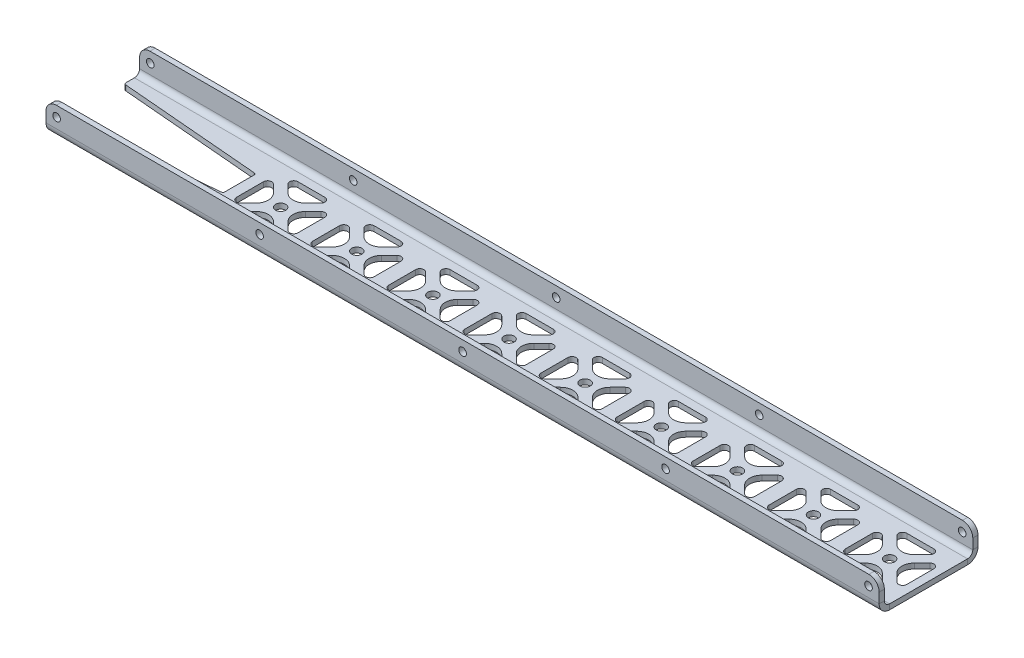
from build123d import *

# Parameters (mm, degrees)
SKETCH1_W                      = 405
SKETCH1_H                      = 48.05
BOSS_EXTRUDE1_DEPTH            = 2.54
EDGE_FLANGE1_STRIP_W           = 15.24
EDGE_FLANGE1_STRIP_H           = 2.54
EDGE_FLANGE1_STRIP_CUT_DEPTH   = 405
EDGE_FLANGE1_STRIP_2_W         = 15.24
EDGE_FLANGE1_STRIP_2_H         = 2.54
EDGE_FLANGE1_STRIP_CUT_2_DEPTH = 405
EDGE_FLANGE1_DEPTH             = 405
EDGE_FLANGE1_BEND_DEPTH        = 405
SKETCH17_R                     = 1.85
CUT_EXTRUDE1_DEPTH             = 209.662532574
CUT_EXTRUDE2_DEPTH             = 205.471148637
SKETCH19_R                     = 2.5
CUT_EXTRUDE3_DEPTH             = 205.471148637
LPATTERN1_COUNT                = 9
LPATTERN1_PITCH                = 37
FILLET1_R                      = 1
FILLET2_R                      = 5


# Sheet-metal steps are written as plain solids
with BuildPart() as part:
    # Sketch1 → Boss-Extrude1 (new body)
    with BuildSketch(Plane(origin=(0, 0, 0), x_dir=(1, 0, 0), z_dir=(0, 1, 0))):
        Rectangle(SKETCH1_W, SKETCH1_H)
    extrude(amount=BOSS_EXTRUDE1_DEPTH)

    # Edge-Flange1 strip (across the edge) → Edge-Flange1 strip cut (cut)
    with BuildSketch(Plane(origin=(202.5, 2.54, -24.025), x_dir=(0, 0, 1), z_dir=(-1, 0, 0))):
        with Locations((-2.54, -1.27)):
            Rectangle(EDGE_FLANGE1_STRIP_W, EDGE_FLANGE1_STRIP_H)
    extrude(amount=EDGE_FLANGE1_STRIP_CUT_DEPTH, mode=Mode.SUBTRACT)

    # Edge-Flange1 strip 2 (across the edge) → Edge-Flange1 strip cut 2 (cut)
    with BuildSketch(Plane(origin=(-202.5, 2.54, 24.025), x_dir=(0, 0, -1), z_dir=(1, 0, 0))):
        with Locations((-2.54, -1.27)):
            Rectangle(EDGE_FLANGE1_STRIP_2_W, EDGE_FLANGE1_STRIP_2_H)
    extrude(amount=EDGE_FLANGE1_STRIP_CUT_2_DEPTH, mode=Mode.SUBTRACT)

    # Edge-Flange1 section (across the edge) → Edge-Flange1 (add)
    with BuildSketch(Plane(origin=(202.5, 2.54, -24.025), x_dir=(0, 0, 1), z_dir=(-1, 0, 0))):
        with BuildLine():
            Line((0, 2.54), (0, 12.46))
            Line((0, 12.46), (2.54, 12.46))
            Line((2.54, 12.46), (2.54, 2.54))
            ThreePointArc((2.54, 2.54), (3.283948776, 0.743948776), (5.08, 0))
            Line((5.08, 0), (5.08, -2.54))
            ThreePointArc((5.08, -2.54), (1.487897552, -1.052102448), (0, 2.54))
        make_face()
    extrude(amount=EDGE_FLANGE1_DEPTH)

    # Edge-Flange1 section 2 (across the edge) → Edge-Flange1 bend (add)
    with BuildSketch(Plane(origin=(-202.5, 2.54, 24.025), x_dir=(0, 0, -1), z_dir=(1, 0, 0))):
        with BuildLine():
            Line((0, 2.54), (0, 12.46))
            Line((0, 12.46), (2.54, 12.46))
            Line((2.54, 12.46), (2.54, 2.54))
            ThreePointArc((2.54, 2.54), (3.283948776, 0.743948776), (5.08, 0))
            Line((5.08, 0), (5.08, -2.54))
            ThreePointArc((5.08, -2.54), (1.487897552, -1.052102448), (0, 2.54))
        make_face()
    extrude(amount=EDGE_FLANGE1_BEND_DEPTH)

    # Sketch17 → Cut-Extrude1 (cut, through all)
    with BuildSketch(Plane.XY.offset(24.025)):
        with Locations((-197.33398, 10)):
            Circle(SKETCH17_R)
        with Locations((-98.66699, 10)):
            Circle(SKETCH17_R)
        with Locations((0, 10)):
            Circle(SKETCH17_R)
        with Locations((98.66699, 10)):
            Circle(SKETCH17_R)
        with Locations((197.33398, 10)):
            Circle(SKETCH17_R)
    extrude(amount=-CUT_EXTRUDE1_DEPTH, mode=Mode.SUBTRACT)

    # Sketch18 → Cut-Extrude2 (cut, through all)
    with BuildSketch(Plane.XZ):
        Polygon((-202.5, -13.945), (-132.5, -8), (-132.5, 8), (-202.5, 13.945), align=None)
    extrude(amount=-CUT_EXTRUDE2_DEPTH, mode=Mode.SUBTRACT)

    # Sketch19 → Cut-Extrude3 (cut, through all)
    with BuildSketch(Plane.XZ):
        with Locations(Location((183.555, 0, 0), (0, 0, 270))):
            Circle(SKETCH19_R)
        with BuildLine():
            Line((191.333174593, 4.242640687), (195.085786438, 7.995252532))
            ThreePointArc((195.085786438, 7.995252532), (197.265366865, 8.428798034), (198.5, 6.581038969))
            Line((198.5, 6.581038969), (198.5, -6.581038969))
            ThreePointArc((198.5, -6.581038969), (197.265366865, -8.428798034), (195.085786438, -7.995252532))
            Line((195.085786438, -7.995252532), (191.333174593, -4.242640687))
            ThreePointArc((191.333174593, -4.242640687), (189.57581528, 0), (191.333174593, 4.242640687))
        make_face()
        with BuildLine():
            Line((175.559747468, 11.530786438), (179.312359313, 7.778174593))
            ThreePointArc((179.312359313, 7.778174593), (183.555, 6.02081528), (187.797640687, 7.778174593))
            Line((187.797640687, 7.778174593), (191.550252532, 11.530786438))
            ThreePointArc((191.550252532, 11.530786438), (191.983798034, 13.710366865), (190.136038969, 14.945))
            Line((190.136038969, 14.945), (176.973961031, 14.945))
            ThreePointArc((176.973961031, 14.945), (175.126201966, 13.710366865), (175.559747468, 11.530786438))
        make_face()
        with BuildLine():
            Line((176.973961031, -14.945), (190.136038969, -14.945))
            ThreePointArc((190.136038969, -14.945), (191.983798034, -13.710366865), (191.550252532, -11.530786438))
            Line((191.550252532, -11.530786438), (187.797640687, -7.778174593))
            ThreePointArc((187.797640687, -7.778174593), (183.555, -6.02081528), (179.312359313, -7.778174593))
            Line((179.312359313, -7.778174593), (175.559747468, -11.530786438))
            ThreePointArc((175.559747468, -11.530786438), (175.126201966, -13.710366865), (176.973961031, -14.945))
        make_face()
        with BuildLine():
            Line((175.776825407, -4.242640687), (172.024213562, -7.995252532))
            ThreePointArc((172.024213562, -7.995252532), (169.844633135, -8.428798034), (168.61, -6.581038969))
            Line((168.61, -6.581038969), (168.61, 6.581038969))
            ThreePointArc((168.61, 6.581038969), (169.844633135, 8.428798034), (172.024213562, 7.995252532))
            Line((172.024213562, 7.995252532), (175.776825407, 4.242640687))
            ThreePointArc((175.776825407, 4.242640687), (177.53418472, 0), (175.776825407, -4.242640687))
        make_face()
    cut_extrude3 = extrude(amount=-CUT_EXTRUDE3_DEPTH, mode=Mode.SUBTRACT)

    # LPattern1: Cut-Extrude3 ×9
    with Locations(*[(-i * LPATTERN1_PITCH, 0, 0) for i in range(1, LPATTERN1_COUNT)]):
        add(cut_extrude3, mode=Mode.SUBTRACT)

    # Fillet1
    fillet1_edges = [part.edges().sort_by_distance(p)[0] for p in [
        (-202.5, 1.27, -13.945),
        (-202.5, 1.27, 13.945),
        (-132.5, 1.27, 8),
        (-132.5, 1.27, -8),
    ]]
    fillet(fillet1_edges, radius=FILLET1_R)

    # Fillet2
    fillet2_edges = [part.edges().sort_by_distance(p)[0] for p in [
        (202.5, 15, -22.755),
        (-202.5, 15, -22.755),
        (-202.5, 15, 22.755),
        (202.5, 15, 22.755),
    ]]
    fillet(fillet2_edges, radius=FILLET2_R)


solid = part.part
